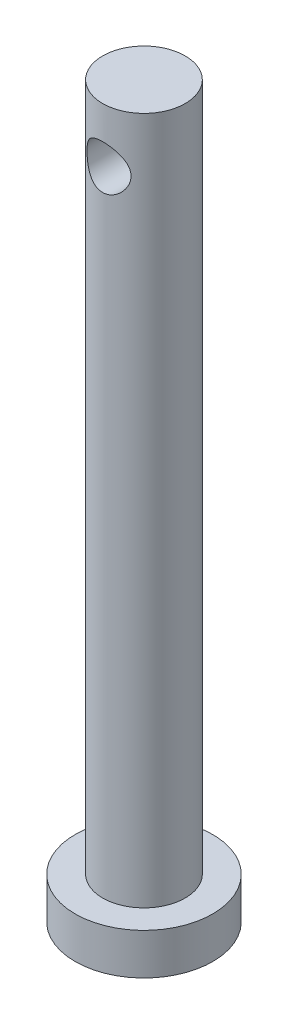
from build123d import *

# Parameters (mm, degrees)
SKETCH_1_R          = 2.5
EXTRUDE_1_DEPTH     = 1.5
SKETCH_2_R          = 1.5
EXTRUDE_2_DEPTH     = 25
SKETCH_3_R          = 0.8
CUT_EXTRUDE_1_DEPTH = 5


with BuildPart() as part:
    # 草图1 → 凸台-拉伸1 (new body)
    with BuildSketch(Plane(origin=(0, 0, 0), x_dir=(1, 0, 0), z_dir=(0, 1, 0))):
        Circle(SKETCH_1_R)
    extrude(amount=EXTRUDE_1_DEPTH)

    # 草图2 → 凸台-拉伸2 (add)
    with BuildSketch(Plane(origin=(0, 1.5, 0), x_dir=(1, 0, 0), z_dir=(0, 1, 0))):
        Circle(SKETCH_2_R)
    extrude(amount=EXTRUDE_2_DEPTH)

    # 草图3 → 切除-拉伸1 (cut, symmetric)
    with BuildSketch(Plane.XY):
        with Locations((0, 24.5)):
            Circle(SKETCH_3_R)
    extrude(amount=CUT_EXTRUDE_1_DEPTH, both=True, mode=Mode.SUBTRACT)


solid = part.part
